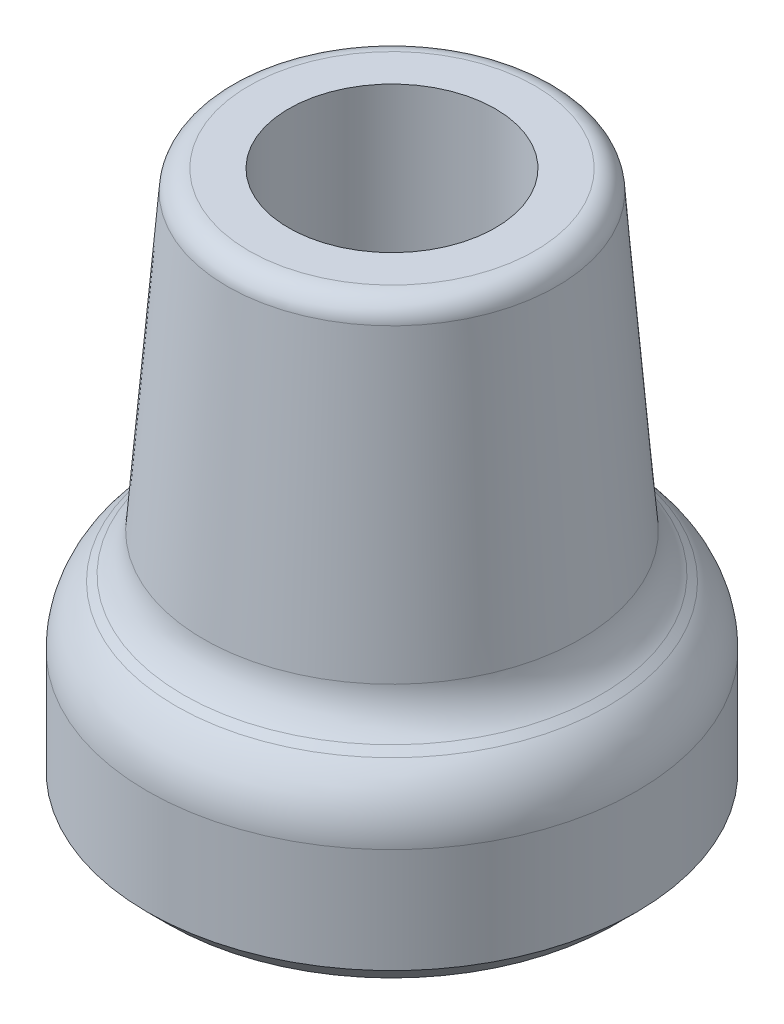
from build123d import *

# Parameters (mm, degrees)
FILLET_1_R     = 2
FILLET_2_R     = 5
FILLET_3_R     = 7
CHAMFER_1_SIZE = 2
FILLET_4_R     = 1


with BuildPart() as part:
    # Эскиз1 → Повернуть1 (revolve)
    with BuildSketch(Plane.XY):
        Polygon((0, 20), (-9.5, 20), (-9.5, 50), (-15, 50), (-17.5, 19), (-22.5, 15), (-22.5, 0), (0, 0), align=None)
    revolve(axis=Axis((0, 0, 0), (0, 1, 0)))

    # Скругление1
    fillet_1_edges = [part.edges().sort_by_distance(p)[0] for p in [
        (15, 50, 0),
    ]]
    fillet(fillet_1_edges, radius=FILLET_1_R)

    # Скругление2
    fillet_2_edges = [part.edges().sort_by_distance(p)[0] for p in [
        (17.5, 19, 0),
    ]]
    fillet(fillet_2_edges, radius=FILLET_2_R)

    # Скругление3
    fillet_3_edges = [part.edges().sort_by_distance(p)[0] for p in [
        (22.5, 15, 0),
    ]]
    fillet(fillet_3_edges, radius=FILLET_3_R)

    # Фаска1
    chamfer_1_edges = [part.edges().sort_by_distance(p)[0] for p in [
        (22.5, 0, 0),
    ]]
    chamfer(chamfer_1_edges, length=CHAMFER_1_SIZE)

    # Скругление4
    fillet_4_edges = [part.edges().sort_by_distance(p)[0] for p in [
        (9.5, 20, 0),
    ]]
    fillet(fillet_4_edges, radius=FILLET_4_R)


solid = part.part
